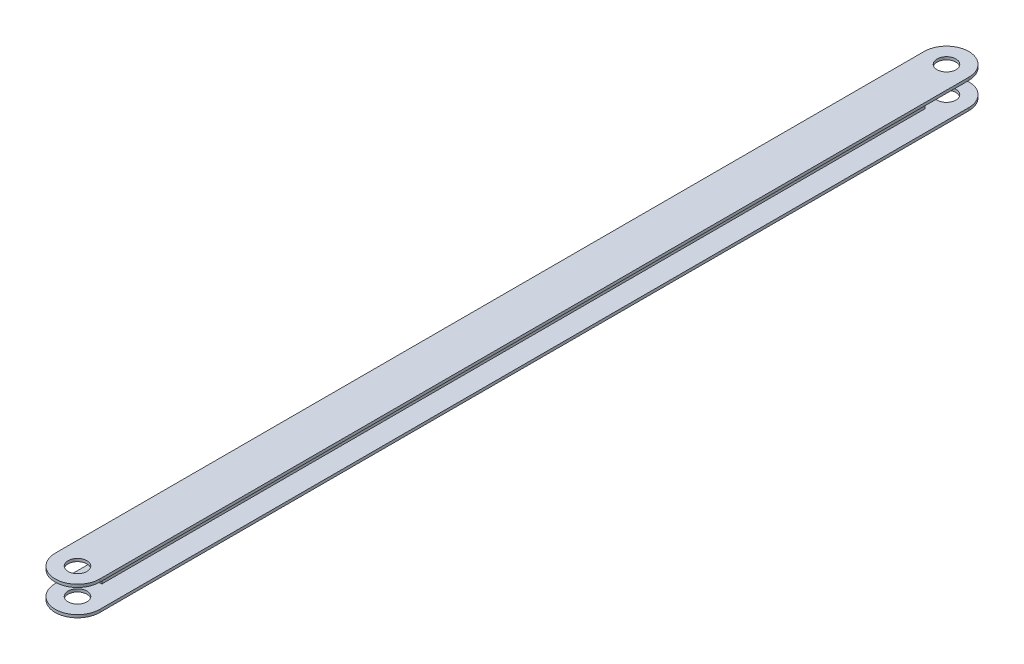
from build123d import *

# Parameters (mm, degrees)
BOSS_EXTRUDE1_DEPTH = 389
SKETCH3_R           = 4
CUT_EXTRUDE2_DEPTH  = 370
SKETCH6_W           = 19.5
SKETCH6_H           = 10
CUT_EXTRUDE4_DEPTH  = 370


with BuildPart() as part:
    # Sketch1 → Boss-Extrude1 (new body)
    with BuildSketch(Plane.XY):
        Polygon((-9.5, 5), (-0.6, 5), (-0.6, -5), (-9.5, -5), (-9.5, -6.2), (9.5, -6.2), (9.5, -5), (0.6, -5), (0.6, 5), (9.5, 5), (9.5, 6.2), (-9.5, 6.2), align=None)
    extrude(amount=BOSS_EXTRUDE1_DEPTH)

    # Sketch3 → Cut-Extrude2 (cut)
    with BuildSketch(Plane(origin=(0, 6.2, 0), x_dir=(1, 0, 0), z_dir=(0, 1, 0))):
        with BuildLine():
            ThreePointArc((14.5, -9.5), (0, 5), (-14.5, -9.5))
            Line((-14.5, -9.5), (-9.5, -9.5))
            ThreePointArc((-9.5, -9.5), (0, 0), (9.5, -9.5))
            Line((9.5, -9.5), (14.5, -9.5))
        make_face()
        with Locations((0, -9.5)):
            Circle(SKETCH3_R)
    cut_extrude2 = extrude(amount=-CUT_EXTRUDE2_DEPTH, mode=Mode.SUBTRACT)

    # Mirror1: Cut-Extrude2 across plane
    add(cut_extrude2.mirror(Plane.XY.offset(194.5)), mode=Mode.SUBTRACT)

    # Sketch6 → Cut-Extrude4 (cut)
    with BuildSketch(Plane.ZY.offset(0.6)):
        with Locations((9.5, 0)):
            Rectangle(SKETCH6_W, SKETCH6_H)
    cut_extrude4 = extrude(amount=-CUT_EXTRUDE4_DEPTH, mode=Mode.SUBTRACT)

    # Mirror2: Cut-Extrude4 across plane
    add(cut_extrude4.mirror(Plane.XY.offset(194.5)), mode=Mode.SUBTRACT)


solid = part.part
